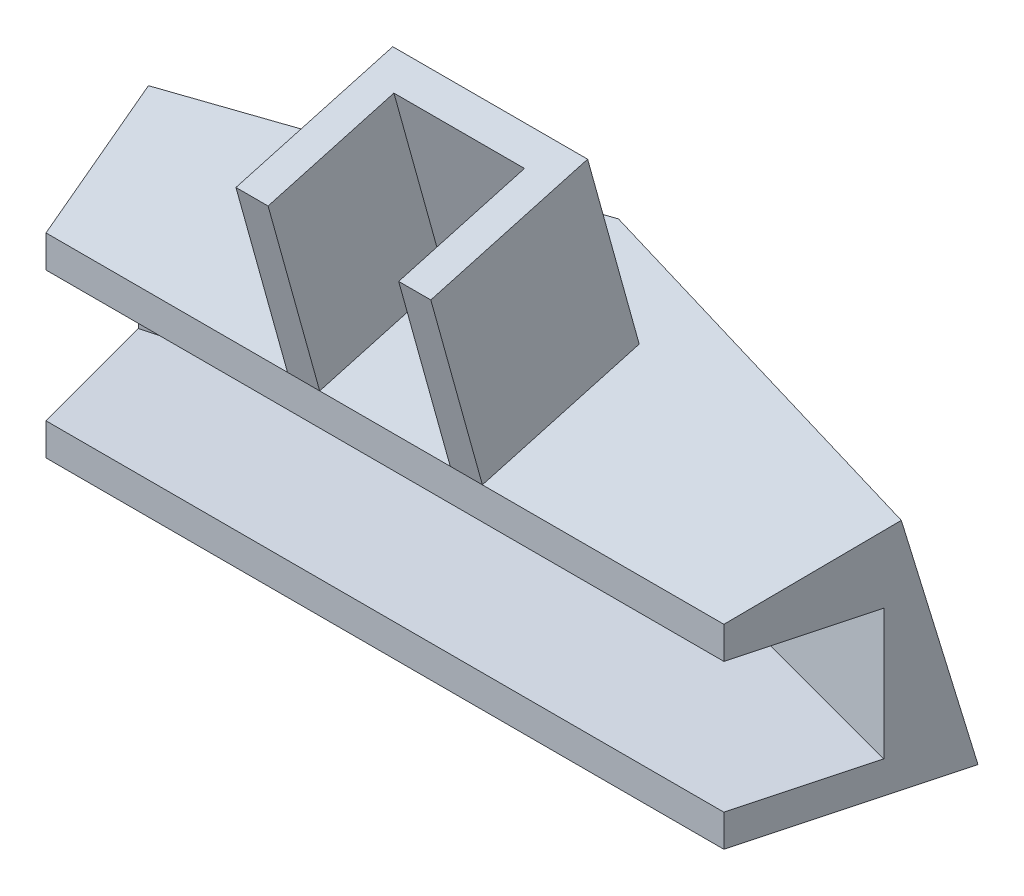
from build123d import *

# Parameters (mm, degrees)
BOSS_EXTRUDE5_DEPTH = 5
BOSS_EXTRUDE6_DEPTH = 20.3
BOSS_EXTRUDE7_DEPTH = 20
CUT_EXTRUDE1_DEPTH  = 90.151426067
CUT_EXTRUDE3_DEPTH  = 84.031866845
BOSS_EXTRUDE9_DEPTH = 30


with BuildPart() as part:
    # Sketch8 → Boss-Extrude5 (new body)
    with BuildSketch(Plane(origin=(0, 0, 0), x_dir=(1, 0, 0), z_dir=(0, 1, 0))):
        Polygon((-63.131930479, 24.805480282), (-52.701522962, -14.121330517), (0, -14.121330517), (0, 41.721630071), align=None)
    boss_extrude5 = extrude(amount=BOSS_EXTRUDE5_DEPTH)

    # Sketch9 → Boss-Extrude6 (add)
    with BuildSketch(Plane(origin=(0, 5, 0), x_dir=(1, 0, 0), z_dir=(0, 1, 0))):
        Polygon((-63.131930479, 24.805480282), (-57.955549577, 5.486963756), (0, 21.016106462), (0, 41.721630071), align=None)
    boss_extrude6 = extrude(amount=BOSS_EXTRUDE6_DEPTH)

    # Sketch10 → Boss-Extrude7 (add)
    with BuildSketch(Plane(origin=(0, 25.3, 0), x_dir=(1, 0, 0), z_dir=(0, 1, 0))):
        Polygon((0, 41.721630071), (0, -14.121330517), (-52.701522962, -14.121330517), (-63.131930479, 24.805480282), align=None)
    boss_extrude7 = extrude(amount=BOSS_EXTRUDE7_DEPTH)

    # Sketch19 → Cut-Extrude1 (cut, through all)
    with BuildSketch(Plane(origin=(-52.701522962, 0, 14.121330517), x_dir=(0.25881904510251774, 0, 0.9659258262890692), z_dir=(-0.9659258262890692, 0, 0.25881904510251774))):
        Polygon((-32.255495471, 0), (-20.117397053, 45.3), (-40.3, 45.3), (-40.3, 0), align=None)
    cut_extrude1 = extrude(amount=-CUT_EXTRUDE1_DEPTH, mode=Mode.SUBTRACT)

    # Sketch22 → Cut-Extrude3 (cut, through all)
    with BuildSketch(Plane(origin=(0, 0, 0), x_dir=(0, 0, -1), z_dir=(1, 0, 0))):
        Polygon((-14.121330517, 30.3), (22.193593674, 40.37381141), (20.827061981, 45.3), (-14.121330517, 45.3), align=None)
    cut_extrude3 = extrude(amount=-CUT_EXTRUDE3_DEPTH, mode=Mode.SUBTRACT)

    # Sketch23 → Boss-Extrude9 (add)
    with BuildSketch(Plane(origin=(0, 31.772345951, 8.813693772), x_dir=(1, 0, 0), z_dir=(0, 0.9636113749942826, 0.26730716036355656))):
        Polygon((-10.15, -5.508067758), (-15.15, -5.508067758), (-15.15, 19.791932242), (0, 19.791932242), (0, 14.791932242), (-10.15, 14.791932242), align=None)
    boss_extrude9 = extrude(amount=BOSS_EXTRUDE9_DEPTH)

    # Mirror1: Boss-Extrude5, Boss-Extrude6, Boss-Extrude7, Cut-Extrude1, Cut-Extrude3, Boss-Extrude9 across plane
    add(boss_extrude5.mirror(Plane(origin=(0, 5, -41.721630071), x_dir=(0, 0, 1), z_dir=(-1, 0, 0))))
    add(boss_extrude6.mirror(Plane(origin=(0, 5, -41.721630071), x_dir=(0, 0, 1), z_dir=(-1, 0, 0))))
    add(boss_extrude7.mirror(Plane(origin=(0, 5, -41.721630071), x_dir=(0, 0, 1), z_dir=(-1, 0, 0))))
    add(cut_extrude1.mirror(Plane(origin=(0, 5, -41.721630071), x_dir=(0, 0, 1), z_dir=(-1, 0, 0))), mode=Mode.SUBTRACT)
    add(cut_extrude3.mirror(Plane(origin=(0, 5, -41.721630071), x_dir=(0, 0, 1), z_dir=(-1, 0, 0))), mode=Mode.SUBTRACT)
    add(boss_extrude9.mirror(Plane(origin=(0, 5, -41.721630071), x_dir=(0, 0, 1), z_dir=(-1, 0, 0))))


solid = part.part
